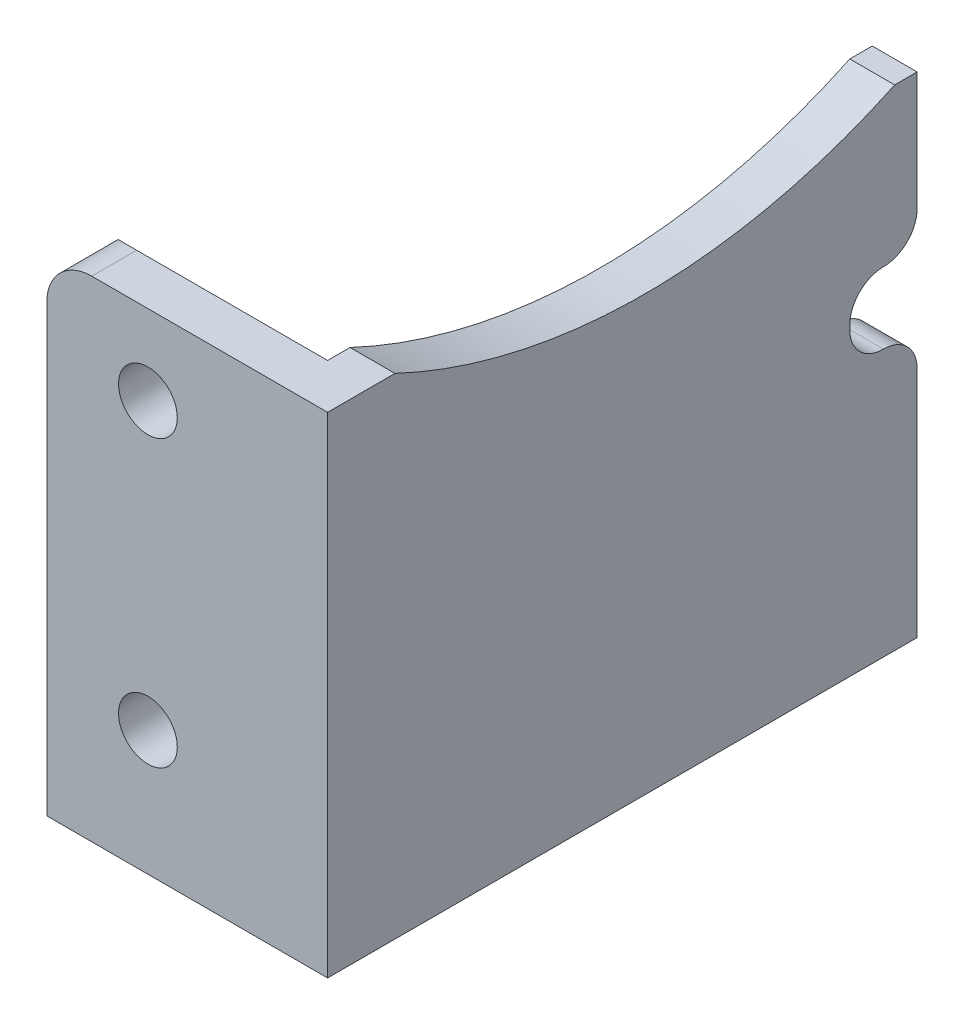
from build123d import *

# Parameters (mm, degrees)
SKETCH1_W               = 25
SKETCH1_H               = 47.625
SKETCH1_R               = 2.6162
BOSS_EXTRUDE1_DEPTH     = 6
SKETCH3_W               = 52.5
SKETCH3_H               = 47.625
BOSS_EXTRUDE2_DEPTH     = 4
BOSS_EXTRUDE3_DEPTH     = 3
CUT_EXTRUDE1_DEPTH      = 72.101270207
CUT_EXTRUDE1_DEPTH_BACK = 72.101270207
SKETCH5_W               = 25
SKETCH5_H               = 4
CHAMFER1_SIZE           = 2
SKETCH6_W               = 6
SKETCH6_H               = 6.35
CUT_EXTRUDE2_DEPTH      = 74.928280279
CUT_EXTRUDE3_DEPTH      = 74.928280279
FILLET2_R               = 3
FILLET1_R               = 3
FILLET3_R               = 4


with BuildPart() as part:
    # Sketch1 → Boss-Extrude1 (new body)
    with BuildSketch(Plane.XY):
        with Locations((-12.5, -23.8125)):
            Rectangle(SKETCH1_W, SKETCH1_H)
        with Locations((-16, -11.1125)):
            Circle(SKETCH1_R, mode=Mode.SUBTRACT)
        with Locations((-16, -36.5125)):
            Circle(SKETCH1_R, mode=Mode.SUBTRACT)
    extrude(amount=-BOSS_EXTRUDE1_DEPTH)

    # Sketch3 → Boss-Extrude2 (add)
    with BuildSketch(Plane(origin=(0, 0, 0), x_dir=(0, 0, -1), z_dir=(1, 0, 0))):
        with Locations((26.25, -23.8125)):
            Rectangle(SKETCH3_W, SKETCH3_H)
    extrude(amount=-BOSS_EXTRUDE2_DEPTH)

    # Sketch4 → Boss-Extrude3 (add)
    with BuildSketch(Plane.XZ.offset(47.625)):
        Polygon((-25, -6), (-4, -52.5), (-4, -6), align=None)
    extrude(amount=-BOSS_EXTRUDE3_DEPTH)

    # Sketch5 → Cut-Extrude1 (cut, two sides: drawn at the far end of the back side and taken through both)
    with BuildSketch(Plane(origin=(0, 0, -6), x_dir=(-1, 0, 0), z_dir=(0, 0, -1)).offset(-CUT_EXTRUDE1_DEPTH_BACK)):
        with Locations((12.5, -2)):
            Rectangle(SKETCH5_W, SKETCH5_H)
    extrude(amount=CUT_EXTRUDE1_DEPTH + CUT_EXTRUDE1_DEPTH_BACK, mode=Mode.SUBTRACT)

    # Chamfer1
    chamfer1_edges = [part.edges().sort_by_distance(p)[0] for p in [
        (-14.5, -4, -6),
    ]]
    chamfer(chamfer1_edges, length=CHAMFER1_SIZE)

    # Sketch6 → Cut-Extrude2 (cut, through all)
    with BuildSketch(Plane.ZY.offset(4)):
        with Locations((-49.5, -20.701)):
            Rectangle(SKETCH6_W, SKETCH6_H)
    extrude(amount=-CUT_EXTRUDE2_DEPTH, mode=Mode.SUBTRACT)

    # Sketch7 → Cut-Extrude3 (cut, through all)
    with BuildSketch(Plane.ZY.offset(4)):
        with BuildLine():
            Line((-50.5, -4), (-6, -4))
            ThreePointArc((-6, -4), (-28.25, -9), (-50.5, -4))
        make_face()
    extrude(amount=-CUT_EXTRUDE3_DEPTH, mode=Mode.SUBTRACT)

    # Fillet2
    fillet2_edges = [part.edges().sort_by_distance(p)[0] for p in [
        (-2, -17.526, -46.5),
        (-2, -23.876, -46.5),
    ]]
    fillet(fillet2_edges, radius=FILLET2_R)
    fillet2_2_edges = [part.edges().sort_by_distance(p)[0] for p in [
        (-2, -17.526, -52.5),
        (-2, -23.876, -52.5),
    ]]
    fillet(fillet2_2_edges, radius=FILLET2_R - 0.0001)  # a hair under: the kernel refuses the full size

    # Fillet1
    fillet1_edges = [part.edges().sort_by_distance(p)[0] for p in [
        (-4, -25.3125, -6),
    ]]
    fillet(fillet1_edges, radius=FILLET1_R)

    # Fillet3
    fillet3_edges = [part.edges().sort_by_distance(p)[0] for p in [
        (-25, -4, -2),
    ]]
    fillet(fillet3_edges, radius=FILLET3_R)


solid = part.part
